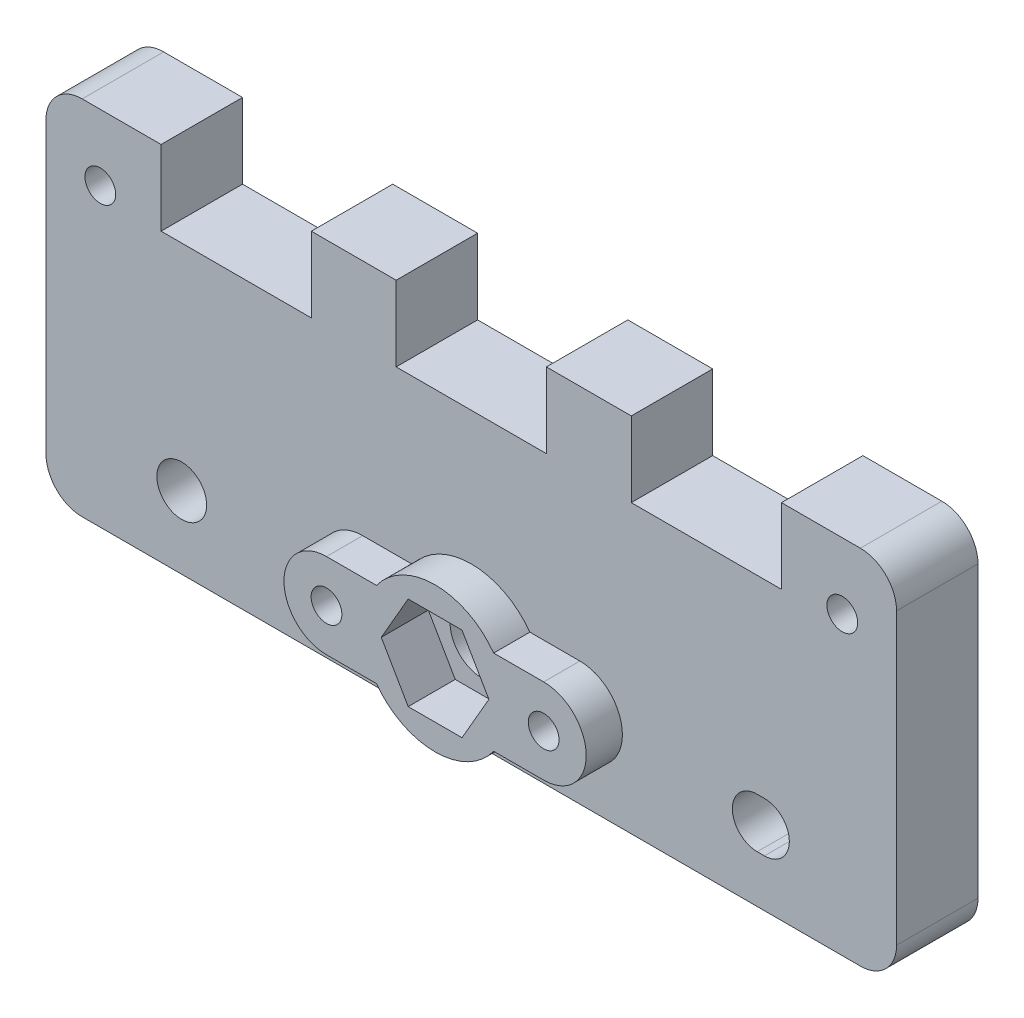
from build123d import *

# Parameters (mm, degrees)
F_01_COMMON_SLIDER_BLANK_DEPTH                 = 9
F_02_START                                     = -0.5
S02_ROUND_LOCATING_GUIDE_AND_RELIEVED_R        = 2.75
F_02_ROUND_LOCATING_GUIDE_AND_RELIEVED_C_DEPTH = 10
F_03_START                                     = -0.5
S03_THREE_DROP_IN_SPRING_SEATS_W               = 16.6
S03_THREE_DROP_IN_SPRING_SEATS_H               = 9.3
F_03_THREE_DROP_IN_SPRING_SEATS_DEPTH          = 10
F_04_START                                     = -0.5
S04_KEEPER_SCREW_HOLES_R                       = 1.7
F_04_KEEPER_SCREW_HOLES_DEPTH                  = 10
F_05_START                                     = 8.8
F_05_REAR_NUT_HOUSING_WITH_FASTENING_BOS_DEPTH = 4.2
F_06_START                                     = 8.8
S06_CENTRAL_WORKING_NUT_SURROUND_R             = 8
F_06_CENTRAL_WORKING_NUT_SURROUND_DEPTH        = 4.2
F_07_START                                     = -0.15
S07_CLEARANCE_TUNNEL_FOR_ROTATING_SPIN_R       = 7.35
F_07_CLEARANCE_TUNNEL_FOR_ROTATING_SPIND_DEPTH = 6.15
F_08_START                                     = -0.1
S08_BOLT_PASSAGE_THROUGH_THRUST_LAND_R         = 3.55
F_08_BOLT_PASSAGE_THROUGH_THRUST_LAND_DEPTH    = 13.3
F_09_START                                     = 7.8
F_09_REAR_OPENING_AF10_HEX_NUT_TRAP_DEPTH      = 5.4
F_10_START                                     = -0.1
S10_NUT_KEEPER_FASTENER_PASSAGES_R             = 1.7
F_10_NUT_KEEPER_FASTENER_PASSAGES_DEPTH        = 13.3


with BuildPart() as part:
    # S01 - Common slider blank → 01 - Common slider blank (new body)
    with BuildSketch(Plane.XY):
        with BuildLine():
            Line((-43, -91), (43, -91))
            ThreePointArc((43, -91), (45.828427125, -89.828427125), (47, -87))
            Line((47, -87), (47, -55))
            ThreePointArc((47, -55), (45.828427125, -52.171572875), (43, -51))
            Line((43, -51), (-43, -51))
            ThreePointArc((-43, -51), (-45.828427125, -52.171572875), (-47, -55))
            Line((-47, -55), (-47, -87))
            ThreePointArc((-47, -87), (-45.828427125, -89.828427125), (-43, -91))
        make_face()
    extrude(amount=F_01_COMMON_SLIDER_BLANK_DEPTH)

    # S02 - Round locating guide and relieved companion → 02 - Round locating guide and relieved companion (cut)
    with BuildSketch(Plane.XY.offset(F_02_START)):
        with Locations((-32, -83)):
            Circle(S02_ROUND_LOCATING_GUIDE_AND_RELIEVED_R)
        with BuildLine():
            Line((31.6, -80.25), (32.4, -80.25))
            ThreePointArc((32.4, -80.25), (35.15, -83), (32.4, -85.75))
            Line((32.4, -85.75), (31.6, -85.75))
            ThreePointArc((31.6, -85.75), (28.85, -83), (31.6, -80.25))
        make_face()
    extrude(amount=F_02_ROUND_LOCATING_GUIDE_AND_RELIEVED_C_DEPTH, mode=Mode.SUBTRACT)

    # S03 - Three drop-in spring seats → 03 - Three drop-in spring seats (cut)
    with BuildSketch(Plane.XY.offset(F_03_START)):
        with Locations((-25.980762114, -54.65)):
            Rectangle(S03_THREE_DROP_IN_SPRING_SEATS_W, S03_THREE_DROP_IN_SPRING_SEATS_H)
        with Locations((25.980762114, -54.65)):
            Rectangle(S03_THREE_DROP_IN_SPRING_SEATS_W, S03_THREE_DROP_IN_SPRING_SEATS_H)
        with Locations((0, -54.65)):
            Rectangle(S03_THREE_DROP_IN_SPRING_SEATS_W, S03_THREE_DROP_IN_SPRING_SEATS_H)
    extrude(amount=F_03_THREE_DROP_IN_SPRING_SEATS_DEPTH, mode=Mode.SUBTRACT)

    # S04 - Keeper screw holes → 04 - Keeper screw holes (cut)
    with BuildSketch(Plane.XY.offset(F_04_START)):
        with Locations((-41, -58.3)):
            Circle(S04_KEEPER_SCREW_HOLES_R)
        with Locations((41, -58.3)):
            Circle(S04_KEEPER_SCREW_HOLES_R)
    extrude(amount=F_04_KEEPER_SCREW_HOLES_DEPTH, mode=Mode.SUBTRACT)

    # S05 - Rear nut housing with fastening bosses → 05 - Rear nut housing with fastening bosses (add)
    with BuildSketch(Plane.XY.offset(F_05_START)):
        with BuildLine():
            Line((-12, -77.3), (12, -77.3))
            ThreePointArc((12, -77.3), (16.7, -82), (12, -86.7))
            Line((12, -86.7), (-12, -86.7))
            ThreePointArc((-12, -86.7), (-16.7, -82), (-12, -77.3))
        make_face()
    extrude(amount=F_05_REAR_NUT_HOUSING_WITH_FASTENING_BOS_DEPTH)

    # S06 - Central working nut surround → 06 - Central working nut surround (add)
    with BuildSketch(Plane.XY.offset(F_06_START)):
        with Locations((0, -82)):
            Circle(S06_CENTRAL_WORKING_NUT_SURROUND_R)
    extrude(amount=F_06_CENTRAL_WORKING_NUT_SURROUND_DEPTH)

    # S07 - Clearance tunnel for rotating spindle retainer → 07 - Clearance tunnel for rotating spindle retainer (cut)
    with BuildSketch(Plane.XY.offset(F_07_START)):
        with Locations((0, -82)):
            Circle(S07_CLEARANCE_TUNNEL_FOR_ROTATING_SPIN_R)
    extrude(amount=F_07_CLEARANCE_TUNNEL_FOR_ROTATING_SPIND_DEPTH, mode=Mode.SUBTRACT)

    # S08 - Bolt passage through thrust land → 08 - Bolt passage through thrust land (cut)
    with BuildSketch(Plane.XY.offset(F_08_START)):
        with Locations((0, -82)):
            Circle(S08_BOLT_PASSAGE_THROUGH_THRUST_LAND_R)
    extrude(amount=F_08_BOLT_PASSAGE_THROUGH_THRUST_LAND_DEPTH, mode=Mode.SUBTRACT)

    # S09 - Rear-opening AF10 hex nut trap → 09 - Rear-opening AF10 hex nut trap (cut)
    with BuildSketch(Plane.XY.offset(F_09_START)):
        Polygon((5.946707773, -82), (2.973353886, -76.85), (-2.973353886, -76.85), (-5.946707773, -82), (-2.973353886, -87.15), (2.973353886, -87.15), align=None)
    extrude(amount=F_09_REAR_OPENING_AF10_HEX_NUT_TRAP_DEPTH, mode=Mode.SUBTRACT)

    # S10 - Nut keeper fastener passages → 10 - Nut keeper fastener passages (cut)
    with BuildSketch(Plane.XY.offset(F_10_START)):
        with Locations((-12, -82)):
            Circle(S10_NUT_KEEPER_FASTENER_PASSAGES_R)
        with Locations((12, -82)):
            Circle(S10_NUT_KEEPER_FASTENER_PASSAGES_R)
    extrude(amount=F_10_NUT_KEEPER_FASTENER_PASSAGES_DEPTH, mode=Mode.SUBTRACT)


solid = part.part
